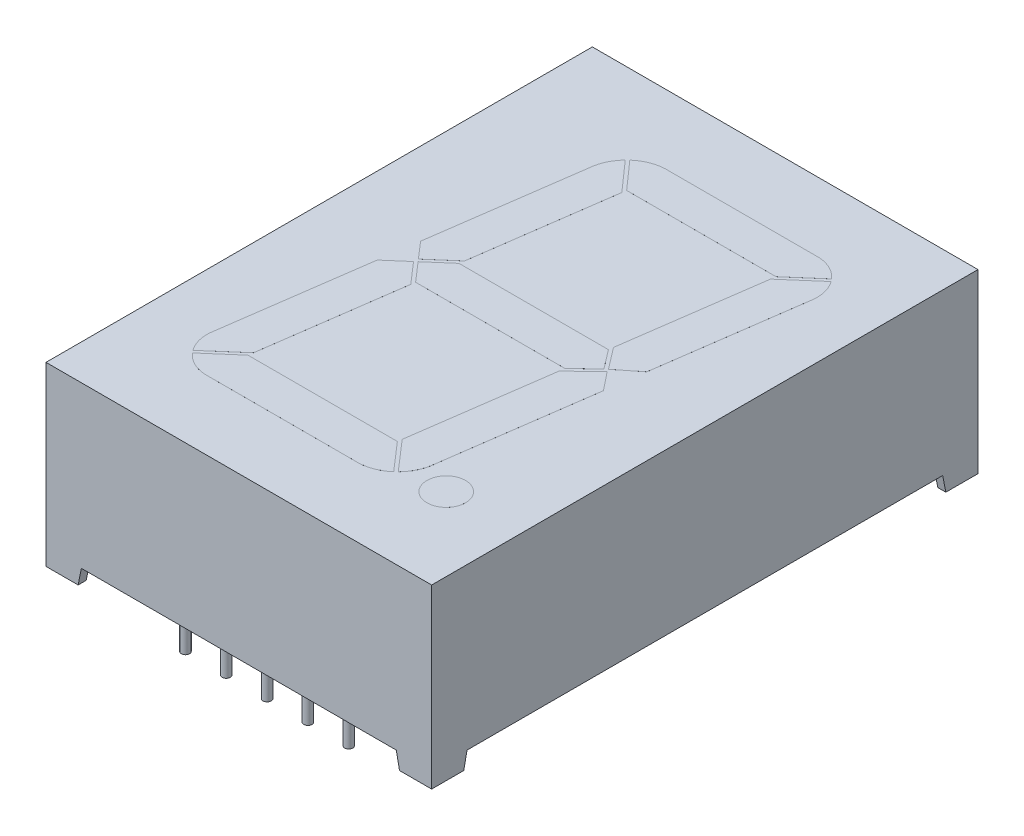
from build123d import *

# Parameters (mm, degrees)
SKETCH1_W                = 24
SKETCH1_H                = 34
BOSS_EXTRUDE1_DEPTH      = 11
CUT_EXTRUDE1_DEPTH       = 32.400636936
CUT_EXTRUDE2_DEPTH       = 38.69615365
SKETCH5_W                = 23
SKETCH5_H                = 33
CUT_EXTRUDE3_DEPTH       = 1.5
FILLET1_START            = -11.5
FILLET1_DEPTH            = 23
FILLET1_START_2          = -17
FILLET1_2_DEPTH          = 34
BOSS_EXTRUDE3_DEPTH      = 2
BOSS_EXTRUDE3_DEPTH_BACK = 2
SKETCH6_R                = 0.255
SKETCH8_R                = 1.203626853
BOSS_EXTRUDE4_DEPTH      = 0.001


with BuildPart() as part:
    # Sketch1 → Boss-Extrude1 (new body)
    with BuildSketch(Plane(origin=(0, 0, 0), x_dir=(1, 0, 0), z_dir=(0, 1, 0))):
        Rectangle(SKETCH1_W, SKETCH1_H)
    extrude(amount=BOSS_EXTRUDE1_DEPTH)

    # Sketch2 → Cut-Extrude1 (cut, through all)
    with BuildSketch(Plane(origin=(12, 0, 0), x_dir=(0, 0, -1), z_dir=(1, 0, 0))):
        Polygon((14.8, 1), (-14.8, 1), (-15, 0), (-15, -1), (15, -1), (15, 0), align=None)
    extrude(amount=-CUT_EXTRUDE1_DEPTH, mode=Mode.SUBTRACT)

    # Sketch3 → Cut-Extrude2 (cut, through all)
    with BuildSketch(Plane.XY.offset(17)):
        Polygon((9.8, 1), (-9.8, 1), (-10, 0), (-10, -1), (10, -1), (10, 0), align=None)
    extrude(amount=-CUT_EXTRUDE2_DEPTH, mode=Mode.SUBTRACT)

    # Sketch5 → Cut-Extrude3 (cut)
    with BuildSketch(Plane.XZ):
        Rectangle(SKETCH5_W, SKETCH5_H)
    extrude(amount=-CUT_EXTRUDE3_DEPTH, mode=Mode.SUBTRACT)

    # Fillet1: read off the stored shape, not the designer's step
    # Fillet1 outline → Fillet1 (add)
    with BuildSketch(Plane.YZ.offset(FILLET1_START)):
        with BuildLine():
            Line((1.5, 16.5), (1, 16.5))
            ThreePointArc((1, 16.5), (1.353553391, 16.353553391), (1.5, 16))
            Line((1.5, 16), (1.5, 16.5))
        make_face()
        with BuildLine():
            Line((1.5, -16.5), (1.5, -16))
            ThreePointArc((1.5, -16), (1.353553391, -16.353553391), (1, -16.5))
            Line((1, -16.5), (1.5, -16.5))
        make_face()
    extrude(amount=FILLET1_DEPTH)

    # Fillet1 2 outline → Fillet1 2 (add)
    with BuildSketch(Plane.XY.offset(FILLET1_START_2)):
        with BuildLine():
            Line((-11.5, 1.5), (-11.5, 1))
            ThreePointArc((-11.5, 1), (-11.353553391, 1.353553391), (-11, 1.5))
            Line((-11, 1.5), (-11.5, 1.5))
        make_face()
        with BuildLine():
            Line((11.5, 1.5), (11, 1.5))
            ThreePointArc((11, 1.5), (11.353553391, 1.353553391), (11.5, 1))
            Line((11.5, 1), (11.5, 1.5))
        make_face()
    extrude(amount=FILLET1_2_DEPTH)

    # Sketch6 → Boss-Extrude3 (add, two sides: drawn at the far end of the back side and taken through both)
    with BuildSketch(Plane.XZ.offset(-BOSS_EXTRUDE3_DEPTH_BACK)):
        with Locations(Location((0, 15.24, 0), (0, 0, 270))):
            Circle(SKETCH6_R)
        with Locations(Location((2.54, 15.24, 0), (0, 0, 270))):
            Circle(SKETCH6_R)
        with Locations(Location((5.08, 15.24, 0), (0, 0, 270))):
            Circle(SKETCH6_R)
        with Locations(Location((-5.08, 15.24, 0), (0, 0, 270))):
            Circle(SKETCH6_R)
        with Locations(Location((-2.54, 15.24, 0), (0, 0, 270))):
            Circle(SKETCH6_R)
        with Locations(Location((-2.54, -15.24, 0), (0, 0, 270))):
            Circle(SKETCH6_R)
        with Locations(Location((-5.08, -15.24, 0), (0, 0, 270))):
            Circle(SKETCH6_R)
        with Locations(Location((5.08, -15.24, 0), (0, 0, 270))):
            Circle(SKETCH6_R)
        with Locations(Location((2.54, -15.24, 0), (0, 0, 270))):
            Circle(SKETCH6_R)
        with Locations(Location((0, -15.24, 0), (0, 0, 270))):
            Circle(SKETCH6_R)
    extrude(amount=BOSS_EXTRUDE3_DEPTH + BOSS_EXTRUDE3_DEPTH_BACK)

    # Sketch8 → Boss-Extrude4 (add)
    with BuildSketch(Plane(origin=(0, 11, 0), x_dir=(1, 0, 0), z_dir=(0, 1, 0))):
        with Locations(Location((7.422365596, -11.514696897, 0), (0, 0, 270))):
            Circle(SKETCH8_R)
        with BuildLine():
            Line((4.437710207, -1.50424181), (3.234164607, -10.067913736))
            Line((3.234164607, -10.067913736), (4.862495803, -11.941094501))
            ThreePointArc((4.862495803, -11.941094501), (5.368748257, -11.200837396), (5.587567885, -10.331130491))
            Line((5.587567885, -10.331130491), (6.873174177, -1.183566406))
            Line((6.873174177, -1.183566406), (5.964953485, -0.043665222))
            Line((5.964953485, -0.043665222), (4.437710207, -1.50424181))
        make_face()
        with BuildLine():
            Line((5.877292712, 0.125030841), (7.205852999, 1.183566406))
            Line((7.205852999, 1.183566406), (8.491459291, 10.331130491))
            ThreePointArc((8.491459291, 10.331130491), (8.411955198, 11.093627172), (8.077597236, 11.783501683))
            Line((8.077597236, 11.783501683), (6.058508073, 10.028334252))
            Line((6.058508073, 10.028334252), (4.854667192, 1.462561294))
            Line((4.854667192, 1.462561294), (5.877292712, 0.125030841))
        make_face()
        with BuildLine():
            Line((6.10106331, 10.331130491), (7.952849968, 11.940864075))
            ThreePointArc((7.952849968, 11.940864075), (7.268624086, 12.470648357), (6.433742131, 12.698263303))
            Line((6.433742131, 12.698263303), (-2.864493083, 12.698263303))
            ThreePointArc((-2.864493083, 12.698263303), (-3.862201278, 12.569201297), (-4.732453708, 12.064484197))
            Line((-4.732453708, 12.064484197), (-3.197171904, 10.331130491))
            Line((-3.197171904, 10.331130491), (6.10106331, 10.331130491))
        make_face()
        Polygon((-4.815457018, -1.183566406), (4.482778196, -1.183566406), (5.720367413, 0), (4.815457018, 1.183566406), (-4.482778196, 1.183566406), (-5.844315597, 0), align=None)
        with BuildLine():
            Line((-5.975923975, 0.15139812), (-4.44022296, 1.486362645))
            Line((-4.44022296, 1.486362645), (-3.233869851, 10.07001103))
            Line((-3.233869851, 10.07001103), (-4.877500084, 11.925691561))
            ThreePointArc((-4.877500084, 11.925691561), (-5.373142616, 11.19102491), (-5.587567885, 10.331130491))
            Line((-5.587567885, 10.331130491), (-6.873174177, 1.183566406))
            Line((-6.873174177, 1.183566406), (-5.975923975, 0.15139812))
        make_face()
        with BuildLine():
            Line((-5.995713717, -0.131608377), (-7.205852999, -1.183566406))
            Line((-7.205852999, -1.183566406), (-8.491459291, -10.331130491))
            ThreePointArc((-8.491459291, -10.331130491), (-8.411955198, -11.093627172), (-8.077597236, -11.783501683))
            Line((-8.077597236, -11.783501683), (-6.058508073, -10.028334252))
            Line((-6.058508073, -10.028334252), (-4.85244972, -1.446783161))
            Line((-4.85244972, -1.446783161), (-5.995713717, -0.131608377))
        make_face()
        with BuildLine():
            Line((-6.10106331, -10.331130491), (-7.952849968, -11.940864075))
            ThreePointArc((-7.952849968, -11.940864075), (-7.268624086, -12.470648357), (-6.433742131, -12.698263303))
            Line((-6.433742131, -12.698263303), (2.864493083, -12.698263303))
            ThreePointArc((2.864493083, -12.698263303), (3.852009379, -12.572635363), (4.716279741, -12.078664154))
            Line((4.716279741, -12.078664154), (3.197171904, -10.331130491))
            Line((3.197171904, -10.331130491), (-6.10106331, -10.331130491))
        make_face()
    extrude(amount=BOSS_EXTRUDE4_DEPTH)


solid = part.part
